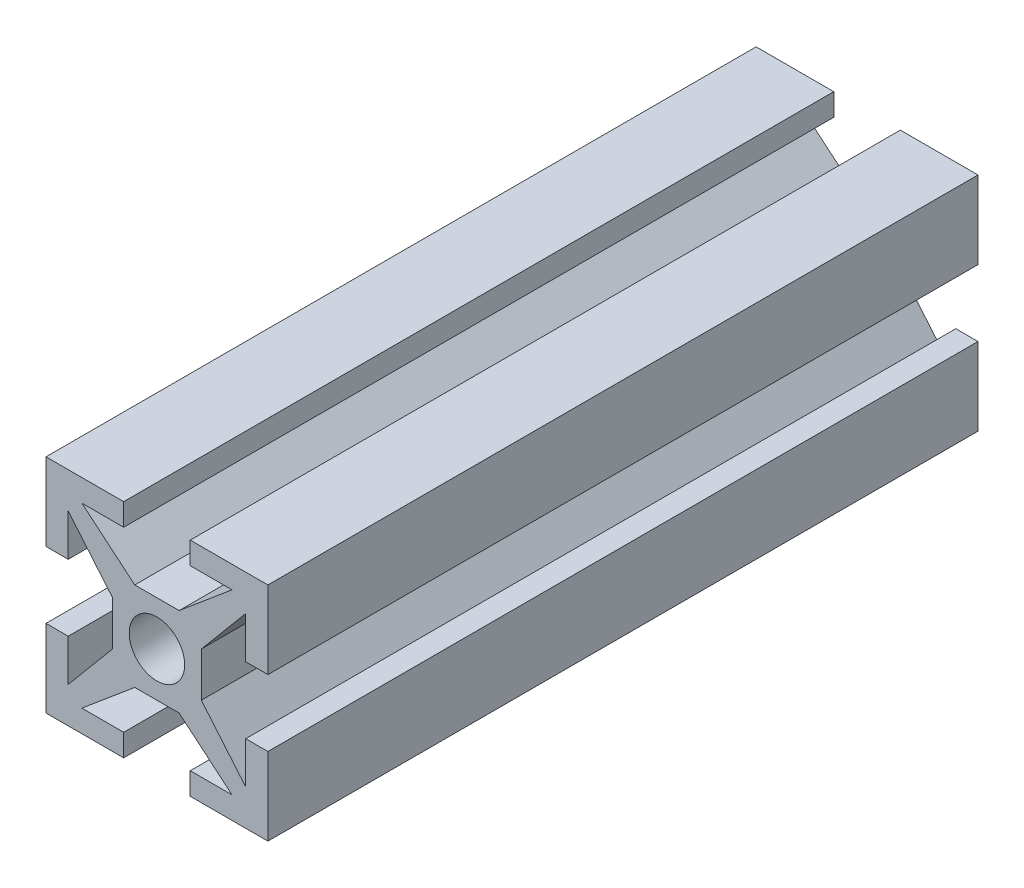
from build123d import *

# Parameters (mm, degrees)
ESQUISSE2_R          = 1.25
MAIN_EXTRUSION_DEPTH = 32


with BuildPart() as part:
    # Esquisse2 → Main Extrusion (new body)
    with BuildSketch(Plane.XY):
        Polygon((-1, -2), (1, -2), (3.383507185, -4), (1.5, -4), (1.5, -5), (5, -5), (5, -1.5), (4, -1.5), (4, -3.383507185), (2, -1), (2, 1), (4, 3.383507185), (4, 1.5), (5, 1.5), (5, 5), (1.5, 5), (1.5, 4), (3.383507185, 4), (1, 2), (-1, 2), (-3.383507185, 4), (-1.5, 4), (-1.5, 5), (-5, 5), (-5, 1.5), (-4, 1.5), (-4, 3.383507185), (-2, 1), (-2, -1), (-4, -3.383507185), (-4, -1.5), (-5, -1.5), (-5, -5), (-1.5, -5), (-1.5, -4), (-3.383507185, -4), align=None)
        Circle(ESQUISSE2_R, mode=Mode.SUBTRACT)
    extrude(amount=MAIN_EXTRUSION_DEPTH)


solid = part.part
